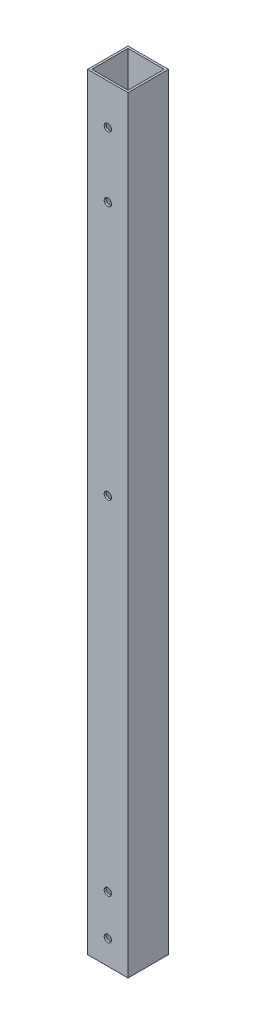
from build123d import *

# Parameters (mm, degrees)
SKETCH1_W           = 25.4
SKETCH1_H           = 25.4
BOSS_EXTRUDE1_DEPTH = 482.6
SKETCH2_R           = 2.286
CUT_EXTRUDE1_DEPTH  = 484.934995635
SKETCH3_R           = 2.286
CUT_EXTRUDE2_DEPTH  = 484.934995635
SKETCH4_R           = 2.286
CUT_EXTRUDE3_DEPTH  = 484.934995635
SKETCH6_R           = 2.286
CUT_EXTRUDE5_DEPTH  = 484.934995635
SKETCH7_R           = 2.286
CUT_EXTRUDE6_DEPTH  = 484.934995635


with BuildPart() as part:
    # Sketch1 → Boss-Extrude1 (new body)
    with BuildSketch(Plane(origin=(0, 0, 0), x_dir=(1, 0, 0), z_dir=(0, 1, 0))):
        with Locations((12.7, 12.7)):
            Rectangle(SKETCH1_W, SKETCH1_H)
        Polygon((1.27, 12.361459156), (1.27, 24.13), (12.7, 24.13), (24.13, 24.13), (24.13, 12.7), (24.13, 1.27), (12.7, 1.27), (1.27, 1.27), align=None, mode=Mode.SUBTRACT)
    extrude(amount=BOSS_EXTRUDE1_DEPTH)

    # Sketch2 → Cut-Extrude1 (cut, through all)
    with BuildSketch(Plane(origin=(0, 0, -25.4), x_dir=(-1, 0, 0), z_dir=(0, 0, -1))):
        with Locations((-12.7, 416.56)):
            Circle(SKETCH2_R)
    extrude(amount=-CUT_EXTRUDE1_DEPTH, mode=Mode.SUBTRACT)

    # Sketch3 → Cut-Extrude2 (cut, through all)
    with BuildSketch(Plane(origin=(0, 0, -25.4), x_dir=(-1, 0, 0), z_dir=(0, 0, -1))):
        with Locations((-12.7, 40.64)):
            Circle(SKETCH3_R)
    extrude(amount=-CUT_EXTRUDE2_DEPTH, mode=Mode.SUBTRACT)

    # Sketch4 → Cut-Extrude3 (cut, through all)
    with BuildSketch(Plane(origin=(0, 0, -25.4), x_dir=(-1, 0, 0), z_dir=(0, 0, -1))):
        with Locations((-12.7, 256.54)):
            Circle(SKETCH4_R)
    extrude(amount=-CUT_EXTRUDE3_DEPTH, mode=Mode.SUBTRACT)

    # Sketch6 → Cut-Extrude5 (cut, through all)
    with BuildSketch(Plane(origin=(0, 0, -25.4), x_dir=(-1, 0, 0), z_dir=(0, 0, -1))):
        with Locations((-12.7, 457.2)):
            Circle(SKETCH6_R)
    extrude(amount=-CUT_EXTRUDE5_DEPTH, mode=Mode.SUBTRACT)

    # Sketch7 → Cut-Extrude6 (cut, through all)
    with BuildSketch(Plane(origin=(0, 0, -25.4), x_dir=(-1, 0, 0), z_dir=(0, 0, -1))):
        with Locations((-12.7, 15.24)):
            Circle(SKETCH7_R)
    extrude(amount=-CUT_EXTRUDE6_DEPTH, mode=Mode.SUBTRACT)


solid = part.part
